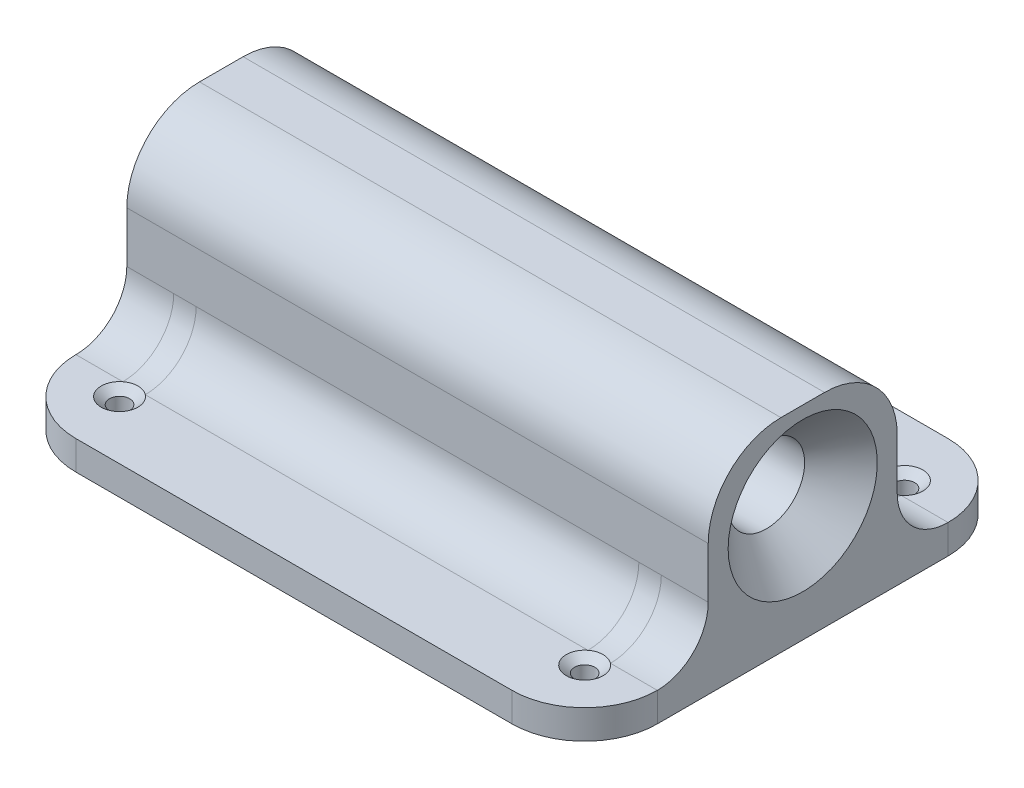
from build123d import *

# Parameters (mm, degrees)
SKETCH1_W                                         = 80
SKETCH1_H                                         = 60
BASE_DEPTH                                        = 4
SKETCH3_W                                         = 80
SKETCH3_H                                         = 26
PIN_BLOCK_DEPTH                                   = 24
SKETCH7_R                                         = 5.2625
PIN_HOLE_DEPTH                                    = 90.911067172
CSK_FOR_3_FLAT_HEAD_MACHINE_SCREW_100_D           = 2.794
CSK_FOR_3_FLAT_HEAD_MACHINE_SCREW_100_CSINK_D     = 5.0546
CSK_FOR_3_FLAT_HEAD_MACHINE_SCREW_100_CSINK_ANGLE = 100
MIRROR2_COPY_1_D                                  = 2.794
MIRROR2_COPY_1_CSINK_D                            = 5.0546
MIRROR2_COPY_1_CSINK_ANGLE                        = 100
FILLET2_R                                         = 10
FILLET3_R                                         = 10
CHAMFER1_SIZE                                     = 5
FILLET4_R                                         = 7


with BuildPart() as part:
    # Sketch1 → Base (new body)
    with BuildSketch(Plane(origin=(0, 0, 0), x_dir=(1, 0, 0), z_dir=(0, 1, 0))):
        Rectangle(SKETCH1_W, SKETCH1_H)
    extrude(amount=BASE_DEPTH)

    # Sketch3 → Pin block (add)
    with BuildSketch(Plane(origin=(0, 4, 0), x_dir=(1, 0, 0), z_dir=(0, 1, 0))):
        Rectangle(SKETCH3_W, SKETCH3_H)
    extrude(amount=PIN_BLOCK_DEPTH)

    # Sketch7 → Pin hole (cut, through all)
    with BuildSketch(Plane(origin=(40, 0, 0), x_dir=(0, 0, -1), z_dir=(1, 0, 0))):
        with Locations((0, 16)):
            Circle(SKETCH7_R)
    extrude(amount=-PIN_HOLE_DEPTH, mode=Mode.SUBTRACT)

    # CSK for #3 Flat Head Machine Screw (100)1 (through all)
    with Locations(Plane(origin=(0, 4, 0), x_dir=(1, 0, 0), z_dir=(0, 1, 0))):
        with Locations((32, -22)):
            csk_for_3_flat_head_machine_screw_100 = CounterSinkHole(CSK_FOR_3_FLAT_HEAD_MACHINE_SCREW_100_D / 2, CSK_FOR_3_FLAT_HEAD_MACHINE_SCREW_100_CSINK_D / 2, counter_sink_angle=CSK_FOR_3_FLAT_HEAD_MACHINE_SCREW_100_CSINK_ANGLE)

    # Mirror1: CSK for #3 Flat Head Machine Screw (100)1 across plane
    add(csk_for_3_flat_head_machine_screw_100.mirror(Plane(origin=(0, 0, 0), x_dir=(0, 0, 1), z_dir=(1, 0, 0))), mode=Mode.SUBTRACT)

    # Mirror2: CSK for #3 Flat Head Machine Screw (100)1 across plane
    add(csk_for_3_flat_head_machine_screw_100.mirror(Plane.XY), mode=Mode.SUBTRACT)

    # Mirror2 copy 1 (through all)
    with Locations(Plane(origin=(0, 4, 0), x_dir=(-1, 0, 0), z_dir=(0, 1, 0))):
        with Locations((32, -22)):
            CounterSinkHole(MIRROR2_COPY_1_D / 2, MIRROR2_COPY_1_CSINK_D / 2, counter_sink_angle=MIRROR2_COPY_1_CSINK_ANGLE)

    # Fillet2
    fillet2_edges = [part.edges().sort_by_distance(p)[0] for p in [
        (-40, 2, -30),
        (40, 2, -30),
        (40, 2, 30),
        (-40, 2, 30),
    ]]
    fillet(fillet2_edges, radius=FILLET2_R)

    # Fillet3
    fillet3_edges = [part.edges().sort_by_distance(p)[0] for p in [
        (0, 28, -13),
        (0, 28, 13),
    ]]
    fillet(fillet3_edges, radius=FILLET3_R)

    # Chamfer1
    chamfer1_edges = [part.edges().sort_by_distance(p)[0] for p in [
        (40, 16, 5.2625),
    ]]
    chamfer(chamfer1_edges, length=CHAMFER1_SIZE)

    # Fillet4
    fillet4_edges = [part.edges().sort_by_distance(p)[0] for p in [
        (0, 4, -13),
        (0, 4, 13),
    ]]
    fillet(fillet4_edges, radius=FILLET4_R)


solid = part.part
